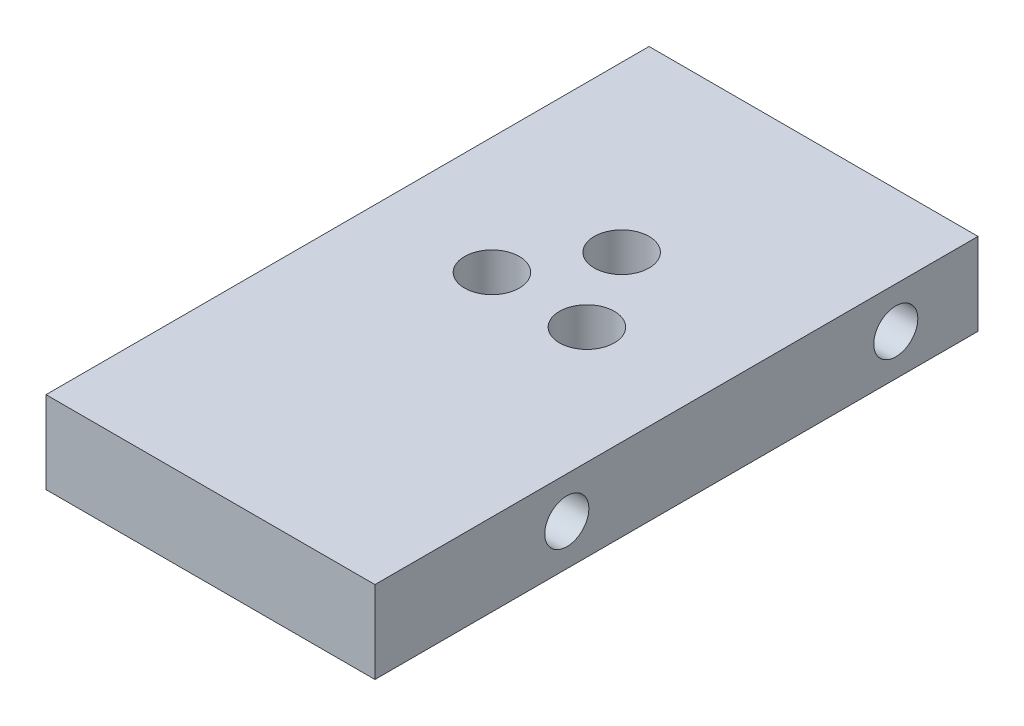
from build123d import *

# Parameters (mm, degrees)
SKETCH1_W                             = 38.1
SKETCH1_H                             = 69.85
BOSS_EXTRUDE1_DEPTH                   = 9.525
F_1_4_0_25_DIAMETER_HOLE1_D           = 6.35
F_1_4_0_25_DIAMETER_HOLE1_DEPTH       = 17.018
F_1_4_0_25_DIAMETER_HOLE1_TIP         = 1.907732465
F_1_4_20_TAPPED_HOLE1_D               = 5.1054
F_1_4_20_TAPPED_HOLE1_DEPTH           = 16.51
F_1_4_20_TAPPED_HOLE1_TIP             = 1.533816902
F_1_4_20_TAPPED_HOLE1_ON_FACE_2_D     = 5.1054
F_1_4_20_TAPPED_HOLE1_ON_FACE_2_DEPTH = 16.51
F_1_4_20_TAPPED_HOLE1_ON_FACE_2_TIP   = 1.533816902


with BuildPart() as part:
    # Sketch1 → Boss-Extrude1 (new body)
    with BuildSketch(Plane(origin=(0, 0, 0), x_dir=(1, 0, 0), z_dir=(0, 1, 0))):
        Rectangle(SKETCH1_W, SKETCH1_H)
    extrude(amount=BOSS_EXTRUDE1_DEPTH)

    # 1/4 (0.25) Diameter Hole1
    with Locations(Plane(origin=(0, 0, 0), x_dir=(-1, 0, 0), z_dir=(0, -1, 0))):
        with Locations((0, 12.7), (5.499261314, 3.175), (-5.499261314, 3.175)):
            Hole(F_1_4_0_25_DIAMETER_HOLE1_D / 2, depth=F_1_4_0_25_DIAMETER_HOLE1_DEPTH)
            with Locations((0, 0, -(F_1_4_0_25_DIAMETER_HOLE1_DEPTH + F_1_4_0_25_DIAMETER_HOLE1_TIP / 2))):  # 118° drill point
                Cone(0, F_1_4_0_25_DIAMETER_HOLE1_D / 2, F_1_4_0_25_DIAMETER_HOLE1_TIP, mode=Mode.SUBTRACT)

    # 1/4-20 Tapped Hole1
    with Locations(Plane(origin=(-19.05, 4.7625, -25.4), x_dir=(0, 0, -1), z_dir=(-1, 0, 0))):
        with Locations((0, 0), (-38.1, 0)):
            Hole(F_1_4_20_TAPPED_HOLE1_D / 2, depth=F_1_4_20_TAPPED_HOLE1_DEPTH)
            with Locations((0, 0, -(F_1_4_20_TAPPED_HOLE1_DEPTH + F_1_4_20_TAPPED_HOLE1_TIP / 2))):  # 118° drill point
                Cone(0, F_1_4_20_TAPPED_HOLE1_D / 2, F_1_4_20_TAPPED_HOLE1_TIP, mode=Mode.SUBTRACT)

    # 1/4-20 Tapped Hole1 on face 2
    with Locations(Plane(origin=(19.05, 4.7625, 12.7), x_dir=(0, 0, 1), z_dir=(1, 0, 0))):
        with Locations((0, 0), (-38.1, 0)):
            Hole(F_1_4_20_TAPPED_HOLE1_ON_FACE_2_D / 2, depth=F_1_4_20_TAPPED_HOLE1_ON_FACE_2_DEPTH)
            with Locations((0, 0, -(F_1_4_20_TAPPED_HOLE1_ON_FACE_2_DEPTH + F_1_4_20_TAPPED_HOLE1_ON_FACE_2_TIP / 2))):  # 118° drill point
                Cone(0, F_1_4_20_TAPPED_HOLE1_ON_FACE_2_D / 2, F_1_4_20_TAPPED_HOLE1_ON_FACE_2_TIP, mode=Mode.SUBTRACT)


solid = part.part
